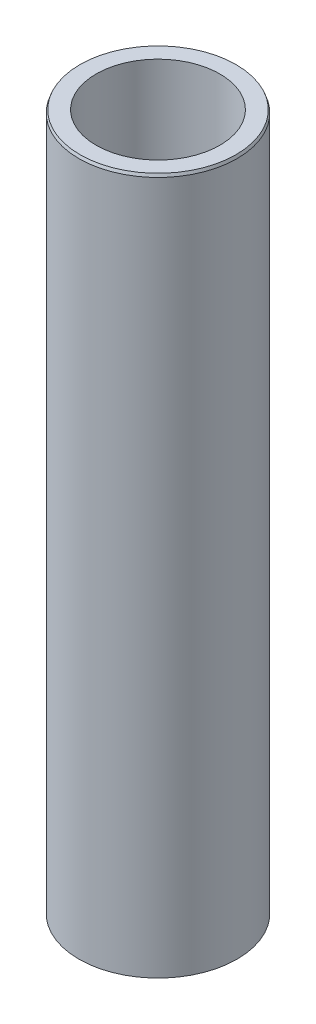
from build123d import *
from OCP.BRepFilletAPI import BRepFilletAPI_MakeChamfer

# Parameters (mm, degrees)
SKETCH1_R           = 55
BOSS_EXTRUDE1_DEPTH = 484.78514368
SKETCH2_R           = 43.001731124
CUT_EXTRUDE1_DEPTH  = 491.985372015
CHAMFER1_SIZE       = 2.003166808
CHAMFER1_SIZE2      = 0.741889905


with BuildPart() as part:
    # Sketch1 → Boss-Extrude1 (new body)
    with BuildSketch(Plane(origin=(0, 0, 0), x_dir=(1, 0, 0), z_dir=(0, 1, 0))):
        Circle(SKETCH1_R)
    extrude(amount=BOSS_EXTRUDE1_DEPTH)

    # Sketch2 → Cut-Extrude1 (cut, through all)
    with BuildSketch(Plane(origin=(0, 0, 0), x_dir=(1, 0, 0), z_dir=(0, 1, 0))):
        Circle(SKETCH2_R)
    extrude(amount=CUT_EXTRUDE1_DEPTH, mode=Mode.SUBTRACT)

    # Chamfer1: one chamfer whose edges measure the first distance from different faces: ONE call of the kernel's chamfer builder (chamfer() names one face for all edges)
    chamfer1_edges_1 = [part.edges().sort_by_distance(p)[0] for p in [
        (-55, 484.78514368, 0),
    ]]
    chamfer1_side_1 = [part.faces().sort_by_distance(p)[0] for p in [
        (-55, 242.39257184, 0),
    ]]
    chamfer1_edges_2 = [part.edges().sort_by_distance(p)[0] for p in [
        (-55, 0, 0),
    ]]
    chamfer1_side_2 = [part.faces().sort_by_distance(p)[0] for p in [
        (-53.444365081, 0, 0),
    ]]
    chamfer1 = BRepFilletAPI_MakeChamfer(part.part.solid().wrapped)
    for e in chamfer1_edges_1:
        chamfer1.Add(CHAMFER1_SIZE, CHAMFER1_SIZE2, e.wrapped, chamfer1_side_1[0].wrapped)  # the first distance lies on this face
    for e in chamfer1_edges_2:
        chamfer1.Add(CHAMFER1_SIZE, CHAMFER1_SIZE2, e.wrapped, chamfer1_side_2[0].wrapped)  # the first distance lies on this face
    add(Compound.cast(chamfer1.Shape()), mode=Mode.REPLACE)


solid = part.part
